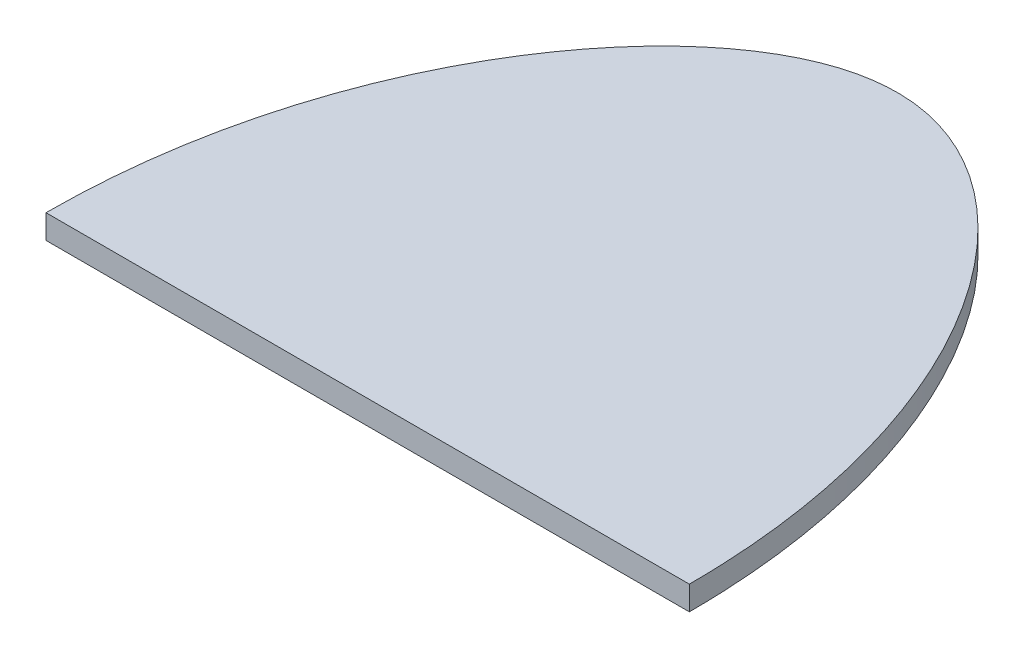
from build123d import *

# Parameters (mm, degrees)
BOSS_EXTRUDE1_DEPTH = 3.175


with BuildPart() as part:
    # Sketch1 → Boss-Extrude1 (new body)
    with BuildSketch(Plane(origin=(0, 0, 0), x_dir=(1, 0, 0), z_dir=(0, 1, 0))):
        with BuildLine():
            Line((0, 0), (85, 0))
            add(Edge.make_bspline(
                [(85, 0), (85, 36), (62.45, 70.283333333), (22.55, 70.283333333), (0, 36), (0, 0)],
                knots=[0.5, 0.5, 0.5, 0.5, 0.95, 1.05, 1.5, 1.5, 1.5, 1.5], degree=3))
        make_face()
    extrude(amount=BOSS_EXTRUDE1_DEPTH)


solid = part.part
